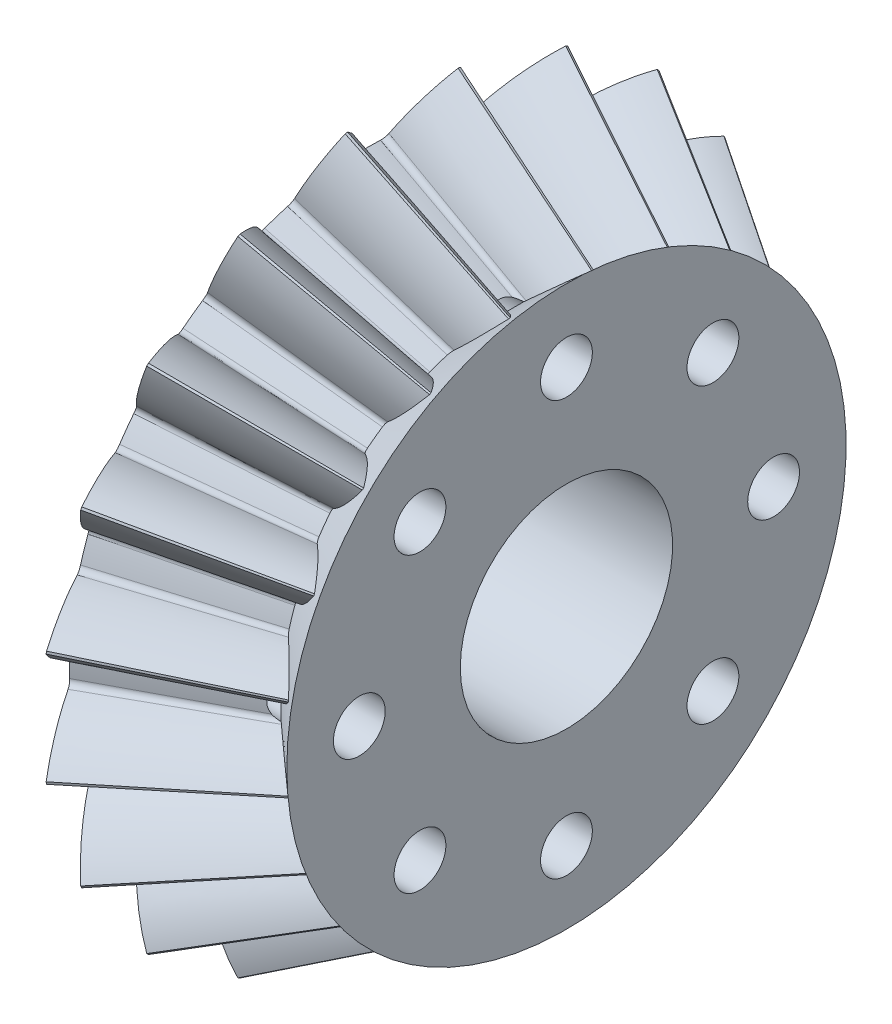
from build123d import *

# Parameters (mm, degrees)
TEETHCUTS_COUNT    = 20
TEETHCUTS_ANGLE    = 342
HUBSKE_R           = 0.5
HUB_DEPTH          = 26.839342423
BORSKE_R           = 3.5
BORE_DEPTH         = 50.0000508
SKETCH6_R          = 10.8
SKETCH7_R          = 8.674027464
SKETCH5_R          = 1
SKETCH5_R_2        = 4.1
CUT_EXTRUDE1_DEPTH = 21.977956739
SKETCH9_R          = 2
CUT_EXTRUDE2_DEPTH = 1.78
SKETCH10_R         = 2
CUT_EXTRUDE3_DEPTH = 0.8


with BuildPart() as part:
    # BasProSke → Base-Revolve (revolve)
    with BuildSketch(Plane(origin=(0, 0, 0), x_dir=(1, 0, 0), z_dir=(0, 1, 0)), mode=Mode.PRIVATE) as base_revolve_sk:
        Polygon((0, 0), (0, 11.310633482), (1.460870897, 13.940201092), (6.519301623, 10.690620231), (5.398972307, 8.674027464), (5.398972307, 0), align=None)
    revolve(base_revolve_sk.sketch.rotate(Axis((-10, 0, 0), (1, 0, 0)), 180), axis=Axis((-10, 0, 0), (1, 0, 0)))

    # Revolve1: read off the stored shape, not the designer's step
    # Revolve1 outline → Revolve1 (revolve)
    with BuildSketch(Plane.YX):
        Polygon((10.690620231, 6.519301623), (9.880736388, 7.78), (8.674027464, 7.78), (8.674027464, 5.398972307), align=None)
    revolve(axis=Axis((0, 0, 0), (1, 0, 0)))

    # ToothCut: read off the stored shape, not the designer's step
    # ToothCut: loft between two sections, ruled curve by curve
    toothcut_from = [
        Edge.make_bspline([(23.164454928, 0.00665235, -0.01016747), (23.161664964, 0.001630416, -0.014467335), (23.15820526, -0.004597052, -0.01360615), (23.155993258, -0.008578655, -0.008061203)], [0, 0, 0, 0, 1, 1, 1, 1], 3, [1, 0.815259328, 0.815259328, 1]),
        Edge.make_bspline([(23.155993258, -0.008578655, 0.008061203), (23.15820526, -0.004597052, 0.01360615), (23.161664964, 0.001630416, 0.014467335), (23.164454928, 0.00665235, 0.01016747)], [0, 0, 0, 0, 1, 1, 1, 1], 3, [1, 0.815259328, 0.815259328, 1]),
        Edge.make_bspline([(23.155993258, -0.008578655, -0.008061203), (23.155646686, -0.009202485, -0.007192431), (23.155358847, -0.009720596, -0.006237051), (23.155134778, -0.010123919, -0.005211788)], [0, 0, 0, 0, 1, 1, 1, 1], 3, [1, 0.994165058, 0.994165058, 1]),
        Edge.make_bspline([(23.155134778, -0.010123919, 0.005211788), (23.155358847, -0.009720596, 0.006237051), (23.155646686, -0.009202485, 0.007192431), (23.155993258, -0.008578655, 0.008061203)], [0, 0, 0, 0, 1, 1, 1, 1], 3, [1, 0.994165058, 0.994165058, 1]),
        Edge.make_bspline([(23.155134778, -0.010123919, -0.005211788), (23.154399117, -0.01144811, -0.001845644), (23.154399117, -0.01144811, 0.001845644), (23.155134778, -0.010123919, 0.005211788)], [0, 0, 0, 0, 1, 1, 1, 1], 3, [1, 0.941277295, 0.941277295, 1]),
        Edge.make_line((23.164454928, 0.00665235, 0.01016747), (23.164454928, 0.00665235, -0.01016747)),
    ]
    toothcut_to = [
        Edge.make_bspline([(1.501039878, 14.012505259, -2.395611714), (1.168595171, 13.414104787, -1.554202), (0.724534446, 12.614795482, -0.970688829), (0.213896264, 11.695646756, -0.704254633)], [0, 0, 0, 0, 1, 1, 1, 1], 3, [1, 0.966191889, 0.966191889, 1]),
        Edge.make_bspline([(0.213896264, 11.695646756, 0.704254633), (0.724534446, 12.614795482, 0.970688829), (1.168595171, 13.414104787, 1.554202), (1.501039878, 14.012505259, 2.395611714)], [0, 0, 0, 0, 1, 1, 1, 1], 3, [1, 0.966191889, 0.966191889, 1]),
        Edge.make_bspline([(0.213896264, 11.695646756, -0.704254633), (0.159051359, 11.596925928, -0.675638367), (0.125222413, 11.536033825, -0.582255228), (0.127532096, 11.540191253, -0.4658506)], [0, 0, 0, 0, 1, 1, 1, 1], 3, [1, 0.850988863, 0.850988863, 1]),
        Edge.make_bspline([(0.127532096, 11.540191253, 0.4658506), (0.125222413, 11.536033825, 0.582255228), (0.159051359, 11.596925928, 0.675638367), (0.213896264, 11.695646756, 0.704254633)], [0, 0, 0, 0, 1, 1, 1, 1], 3, [1, 0.850988863, 0.850988863, 1]),
        Edge.make_bspline([(0.127532096, 11.540191253, -0.4658506), (0.133692605, 11.551280171, -0.155369877), (0.133692605, 11.551280171, 0.155369877), (0.127532096, 11.540191253, 0.4658506)], [0, 0, 0, 0, 1, 1, 1, 1], 3, [1, 0.999444268, 0.999444268, 1]),
        Edge.make_line((1.501039878, 14.012505259, 2.395611714), (1.501039878, 14.012505259, -2.395611714)),
    ]
    toothcut = Solid(Shell([*[Face.make_surface_from_curves(toothcut_from[k], toothcut_to[k]) for k in range(6)], Face(Wire(toothcut_from)), Face(Wire(toothcut_to))]))
    add(toothcut, mode=Mode.SUBTRACT)

    # TeethCuts: ToothCut ×20 about axis
    teethcuts_axis = Axis((-10, 0, 0), (1, 0, 0))
    for i in range(1, TEETHCUTS_COUNT):
        add(toothcut.rotate(teethcuts_axis, i * TEETHCUTS_ANGLE / (TEETHCUTS_COUNT - 1)), mode=Mode.SUBTRACT)

    # HubSke → Hub (add)
    with BuildSketch(Plane.ZY):
        with Locations(Location((0, 0, 0), (0, 0, 180))):
            Circle(HUBSKE_R)
    extrude(amount=HUB_DEPTH)

    # BorSke → Bore (cut, symmetric)
    with BuildSketch(Plane(origin=(0, 0, 0), x_dir=(0, 0, -1), z_dir=(1, 0, 0))):
        with Locations(Location((0, 0, 0), (0, 0, 180))):
            Circle(BORSKE_R)
    extrude(amount=BORE_DEPTH, both=True, mode=Mode.SUBTRACT)

    # Sketch6 → Loft1 section 0
    with BuildSketch(Plane.ZY.offset(-7.78)):
        Circle(SKETCH6_R)
    # Sketch7 → Loft1 section 1
    with BuildSketch(Plane(origin=(5.398972307, 0, 0), x_dir=(0, 0, -1), z_dir=(1, 0, 0))):
        Circle(SKETCH7_R)
    loft()

    # Sketch5 → Cut-Extrude1 (cut, through all)
    with BuildSketch(Plane.ZY):
        with Locations((0, -8)):
            Circle(SKETCH5_R)
        with Locations((5.656854249, -5.656854249)):
            Circle(SKETCH5_R)
        with Locations((8, 0)):
            Circle(SKETCH5_R)
        with Locations((0, 8)):
            Circle(SKETCH5_R)
        with Locations((5.656854249, 5.656854249)):
            Circle(SKETCH5_R)
        Circle(SKETCH5_R_2)
        with Locations((-5.656854249, 5.656854249)):
            Circle(SKETCH5_R)
        with Locations((-8, 0)):
            Circle(SKETCH5_R)
        with Locations((-5.656854249, -5.656854249)):
            Circle(SKETCH5_R)
    extrude(amount=-CUT_EXTRUDE1_DEPTH, mode=Mode.SUBTRACT)

    # Sketch9 → Cut-Extrude2 (cut)
    with BuildSketch(Plane.ZY):
        with Locations((0, -8)):
            Circle(SKETCH9_R)
        with Locations((5.656854249, -5.656854249)):
            Circle(SKETCH9_R)
        with Locations((8, 0)):
            Circle(SKETCH9_R)
        with Locations((5.656854249, 5.656854249)):
            Circle(SKETCH9_R)
        with Locations((0, 8)):
            Circle(SKETCH9_R)
        with Locations((-5.656854249, 5.656854249)):
            Circle(SKETCH9_R)
        with Locations((-8, 0)):
            Circle(SKETCH9_R)
        with Locations((-5.656854249, -5.656854249)):
            Circle(SKETCH9_R)
    extrude(amount=-CUT_EXTRUDE2_DEPTH, mode=Mode.SUBTRACT)

    # Sketch10 → Cut-Extrude3 (cut)
    with BuildSketch(Plane.ZY.offset(-1.78)):
        with Locations((0, 8)):
            Circle(SKETCH10_R)
    extrude(amount=-CUT_EXTRUDE3_DEPTH, mode=Mode.SUBTRACT)


solid = part.part
